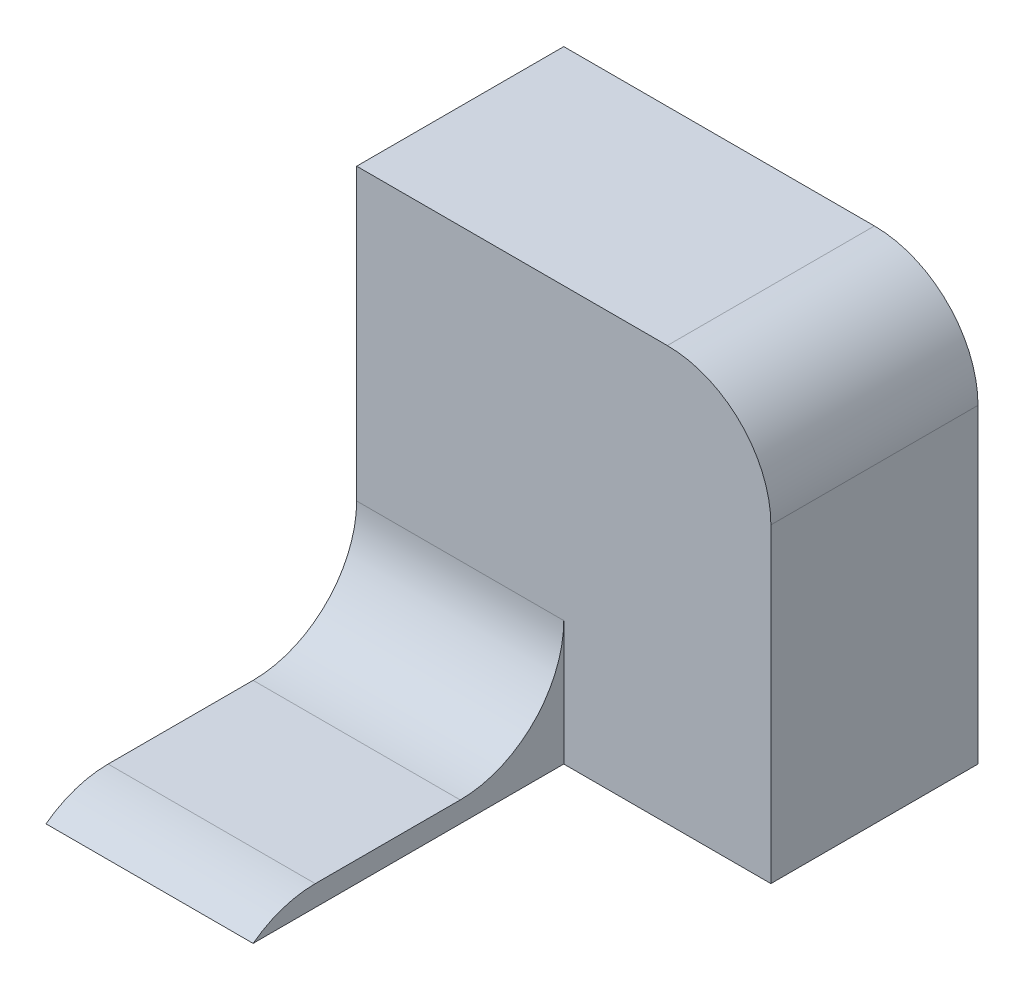
from build123d import *

# Parameters (mm, degrees)
SKETCH1_W           = 20
SKETCH1_H           = 2
BOSS_EXTRUDE1_DEPTH = 30
SKETCH2_W           = 40
SKETCH2_H           = 40
BOSS_EXTRUDE2_DEPTH = 20
FILLET1_R           = 10


with BuildPart() as part:
    # Sketch1 → Boss-Extrude1 (new body)
    with BuildSketch(Plane.XY):
        with Locations((-20, -1)):
            Rectangle(SKETCH1_W, SKETCH1_H)
    extrude(amount=BOSS_EXTRUDE1_DEPTH)

    # Sketch2 → Boss-Extrude2 (add)
    with BuildSketch(Plane.XY):
        with Locations((-10, 18)):
            Rectangle(SKETCH2_W, SKETCH2_H)
    extrude(amount=-BOSS_EXTRUDE2_DEPTH)

    # Fillet1
    # the kernel refuses this fillet: 10 mm, written as the material it adds along each edge
    with BuildSketch(Plane(origin=(-10, 0, 0), x_dir=(0, 1, 0), z_dir=(-1, 0, 0))) as fillet1_piece_1:
        with BuildLine():
            CenterArc((FILLET1_R, -FILLET1_R), FILLET1_R, 90, 90)
            Line((0, -FILLET1_R), (0, 0))
            Line((0, 0), (FILLET1_R, 0))
        make_face()
    extrude(amount=20)
    # the kernel refuses this fillet: 10 mm, written as the material it takes off along each edge
    with BuildSketch(Plane(origin=(10, 38, 25), x_dir=(-1, 0, 0), z_dir=(0, 0, -1))) as fillet1_2_piece_1:
        with BuildLine():
            CenterArc((FILLET1_R, -FILLET1_R), FILLET1_R, 90, 90)
            Line((0, -FILLET1_R), (0, 0))
            Line((0, 0), (FILLET1_R, 0))
        make_face()
    extrude(amount=70, mode=Mode.SUBTRACT)
    with BuildSketch(Plane(origin=(5, 0, 30), x_dir=(0, 0, -1), z_dir=(-1, 0, 0))) as fillet1_2_piece_2:
        with BuildLine():
            CenterArc((6, 10), FILLET1_R, 233.130102354, 36.869897646)
            Line((0, 2), (0, 0))
            Line((0, 0), (6, 0))
        make_face()
    extrude(amount=50, mode=Mode.SUBTRACT)


solid = part.part
